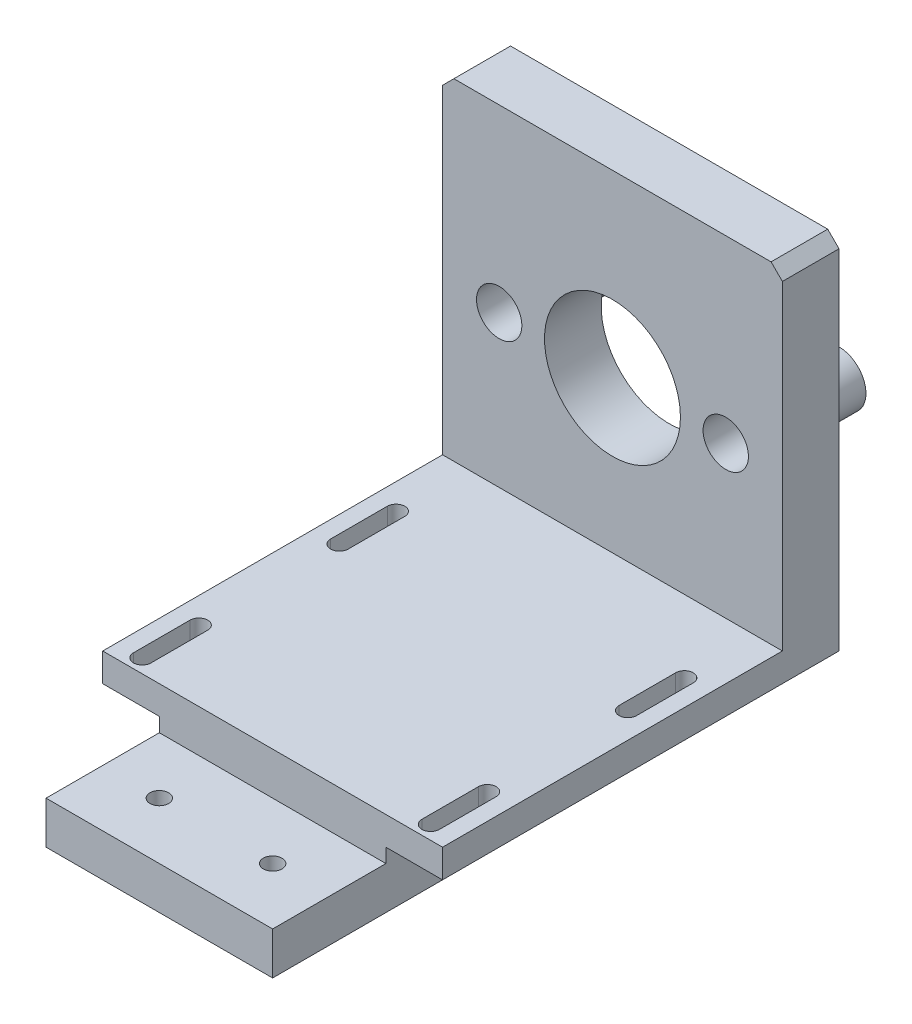
from build123d import *

# Parameters (mm, degrees)
SKETCH_1_W          = 60
SKETCH_1_H          = 63.5
SKETCH_1_R          = 12
SKETCH_1_R_2        = 4
EXTRUDE_1_DEPTH     = 10
CHAMFER_1_SIZE      = 0.25
SKETCH_2_W          = 60
SKETCH_2_H          = 5
EXTRUDE_2_DEPTH     = 60
MM_START            = -31.75
MM_1_DEPTH          = 5
SKETCH_8_R          = 4.75
SKETCH_8_R_2        = 4.25
EXTRUDE_3_DEPTH     = 10
EXTRUDE_4_DEPTH     = 20
CHAMFER_4_SIZE      = 2
HOLE_WIZARD_2_D     = 5.4
HOLE_WIZARD_2_DEPTH = 2
HOLE_WIZARD_3_D     = 3.3


# Read off the part's stored shape, not the designer's step: 大小mm 暗销槽口1
with BuildPart() as part:
    # 草图1 → 凸台-拉伸1 (new body)
    with BuildSketch(Plane.XY):
        Rectangle(SKETCH_1_W, SKETCH_1_H)
        Circle(SKETCH_1_R, mode=Mode.SUBTRACT)
        with Locations((20, 0)):
            Circle(SKETCH_1_R_2, mode=Mode.SUBTRACT)
        with Locations(Location((-20, 0, 0), (0, 0, 180))):
            Circle(SKETCH_1_R_2, mode=Mode.SUBTRACT)
    extrude(amount=EXTRUDE_1_DEPTH)

    # 倒角1
    chamfer_1_edges = [part.edges().sort_by_distance(p)[0] for p in [
        (16, 0, 0),
        (-16, 0, 0),
    ]]
    chamfer(chamfer_1_edges, length=CHAMFER_1_SIZE)

    # 草图2 → 凸台-拉伸2 (add)
    with BuildSketch(Plane.XY.offset(10)):
        with Locations((0, -29.25)):
            Rectangle(SKETCH_2_W, SKETCH_2_H)
    extrude(amount=EXTRUDE_2_DEPTH)

    # 大小mm 暗销槽口1 outline → 大小mm 暗销槽口1 (cut)
    with BuildSketch(Plane(origin=(0, 0, 0), x_dir=(1, 0, 0), z_dir=(0, 1, 0)).offset(MM_START)):
        with BuildLine():
            ThreePointArc((23.909259259, -32.749042146), (25.459259259, -34.299042146), (27.009259259, -32.749042146))
            Line((27.009259259, -32.749042146), (27.009259259, -22.749042146))
            ThreePointArc((27.009259259, -22.749042146), (25.459259259, -21.199042146), (23.909259259, -22.749042146))
            Line((23.909259259, -22.749042146), (23.909259259, -32.749042146))
        make_face()
        with BuildLine():
            Line((27.009259259, -67.557471264), (27.009259259, -57.557471264))
            ThreePointArc((27.009259259, -57.557471264), (25.459259259, -56.007471264), (23.909259259, -57.557471264))
            Line((23.909259259, -57.557471264), (23.909259259, -67.557471264))
            ThreePointArc((23.909259259, -67.557471264), (25.459259259, -69.107471264), (27.009259259, -67.557471264))
        make_face()
        with BuildLine():
            Line((-23.909259259, -67.557471264), (-23.909259259, -57.557471264))
            ThreePointArc((-23.909259259, -57.557471264), (-25.459259259, -56.007471264), (-27.009259259, -57.557471264))
            Line((-27.009259259, -57.557471264), (-27.009259259, -67.557471264))
            ThreePointArc((-27.009259259, -67.557471264), (-25.459259259, -69.107471264), (-23.909259259, -67.557471264))
        make_face()
        with BuildLine():
            Line((-23.909259259, -32.749042146), (-23.909259259, -22.749042146))
            ThreePointArc((-23.909259259, -22.749042146), (-25.459259259, -21.199042146), (-27.009259259, -22.749042146))
            Line((-27.009259259, -22.749042146), (-27.009259259, -32.749042146))
            ThreePointArc((-27.009259259, -32.749042146), (-25.459259259, -34.299042146), (-23.909259259, -32.749042146))
        make_face()
    extrude(amount=MM_1_DEPTH, mode=Mode.SUBTRACT)

    # 草图8 → 凸台-拉伸3 (add)
    with BuildSketch(Plane(origin=(0, 0, 0), x_dir=(-1, 0, 0), z_dir=(0, 0, -1))):
        with Locations((20, 0)):
            Circle(SKETCH_8_R)
        with Locations((20, 0)):
            Circle(SKETCH_8_R_2, mode=Mode.SUBTRACT)
    extrude_3 = extrude(amount=EXTRUDE_3_DEPTH)

    # 镜向1: 凸台-拉伸3 across plane
    add(extrude_3.mirror(Plane.ZY))

    # 草图9 → 凸台-拉伸4 (add, symmetric)
    with BuildSketch(Plane.ZY):
        Polygon((0, -31.75), (-10, -41.75), (90, -41.75), (90, -34.25), (70, -34.25), (70, -31.75), align=None)
    extrude(amount=EXTRUDE_4_DEPTH, both=True)

    # 倒角4
    chamfer_4_edges = [part.edges().sort_by_distance(p)[0] for p in [
        (-30, 31.75, 5),
        (30, 31.75, 5),
    ]]
    chamfer(chamfer_4_edges, length=CHAMFER_4_SIZE)

    # 孔2
    with Locations(Plane(origin=(0, -41.75, 0), x_dir=(-1, 0, 0), z_dir=(0, -1, 0))):
        with Locations((-10, -80)):
            hole_wizard_2 = Hole(HOLE_WIZARD_2_D / 2, depth=HOLE_WIZARD_2_DEPTH)

    # 孔3 (through all)
    with Locations(Plane(origin=(0, -41.75, 0), x_dir=(-1, 0, 0), z_dir=(0, -1, 0))):
        with Locations((-10, -80)):
            hole_wizard_3 = Hole(HOLE_WIZARD_3_D / 2)

    # 镜向2: 孔2, 孔3 across plane
    add(hole_wizard_2.mirror(Plane.ZY), mode=Mode.SUBTRACT)
    add(hole_wizard_3.mirror(Plane.ZY), mode=Mode.SUBTRACT)


solid = part.part
